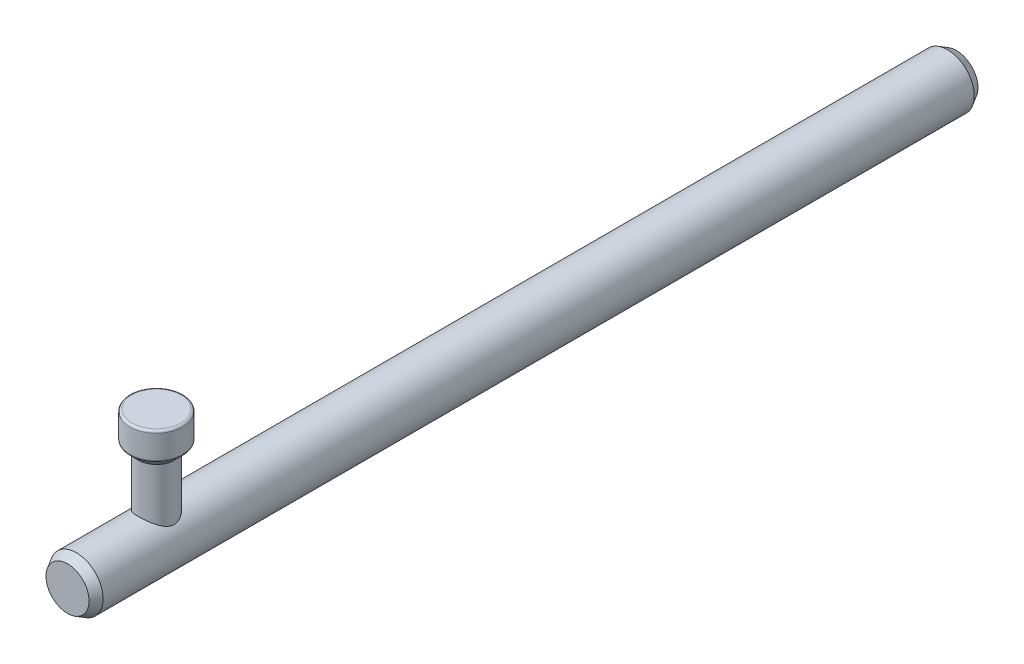
from build123d import *
from OCP.BRepFilletAPI import BRepFilletAPI_MakeChamfer

# Parameters (mm, degrees)
BOSS_EXTRUDE1_DEPTH      = 50
BOSS_EXTRUDE1_DEPTH_BACK = 150
SKETCH1_R                = 6
SKETCH2_R                = 4
BOSS_EXTRUDE2_DEPTH      = 25
SKETCH3_R                = 6
BOSS_EXTRUDE3_DEPTH      = 8
CHAMFER1_SIZE            = 2
CHAMFER1_SIZE2           = 1.154700538
CHAMFER2_SIZE            = 2
FILLET1_R                = 0.5


with BuildPart() as part:
    # Sketch1 → Boss-Extrude1 (new, two sides: drawn at the far end of the back side and taken through both)
    with BuildSketch(Plane.XY.offset(-BOSS_EXTRUDE1_DEPTH_BACK)):
        Circle(SKETCH1_R)
    extrude(amount=BOSS_EXTRUDE1_DEPTH + BOSS_EXTRUDE1_DEPTH_BACK)

    # Sketch2 → Boss-Extrude2 (add)
    with BuildSketch(Plane(origin=(0, 0, 0), x_dir=(1, 0, 0), z_dir=(0, 1, 0))):
        with Locations(Location((0, -30, 0), (0, 0, 90))):
            Circle(SKETCH2_R)
    extrude(amount=BOSS_EXTRUDE2_DEPTH)

    # Sketch3 → Boss-Extrude3 (add)
    with BuildSketch(Plane(origin=(0, 25, 0), x_dir=(1, 0, 0), z_dir=(0, 1, 0))):
        with Locations(Location((0, -30, 0), (0, 0, 270))):
            Circle(SKETCH3_R)
    extrude(amount=-BOSS_EXTRUDE3_DEPTH)

    # Chamfer1: one chamfer whose edges measure the first distance from different faces: ONE call of the kernel's chamfer builder (chamfer() names one face for all edges)
    chamfer1_edges_1 = [part.edges().sort_by_distance(p)[0] for p in [
        (-6, 0, 50),
    ]]
    chamfer1_side_1 = [part.faces().sort_by_distance(p)[0] for p in [
        (-6, 0, 25),
    ]]
    chamfer1_edges_2 = [part.edges().sort_by_distance(p)[0] for p in [
        (-6, 0, -150),
    ]]
    chamfer1_side_2 = [part.faces().sort_by_distance(p)[0] for p in [
        (-6, 0, -75),
    ]]
    chamfer1 = BRepFilletAPI_MakeChamfer(part.part.solid().wrapped)
    for e in chamfer1_edges_1:
        chamfer1.Add(CHAMFER1_SIZE, CHAMFER1_SIZE2, e.wrapped, chamfer1_side_1[0].wrapped)  # the first distance lies on this face
    for e in chamfer1_edges_2:
        chamfer1.Add(CHAMFER1_SIZE, CHAMFER1_SIZE2, e.wrapped, chamfer1_side_2[0].wrapped)  # the first distance lies on this face
    add(Compound.cast(chamfer1.Shape()), mode=Mode.REPLACE)

    # Chamfer2
    chamfer2_edges = [part.edges().sort_by_distance(p)[0] for p in [
        (0, 17, 24),
    ]]
    chamfer(chamfer2_edges, length=CHAMFER2_SIZE - 0.0001)  # a hair under: the kernel refuses the full size

    # Fillet1
    fillet1_edges = [part.edges().sort_by_distance(p)[0] for p in [
        (0, 18.9999, 24),
        (0, 25, 24),
    ]]
    fillet(fillet1_edges, radius=FILLET1_R)


solid = part.part
